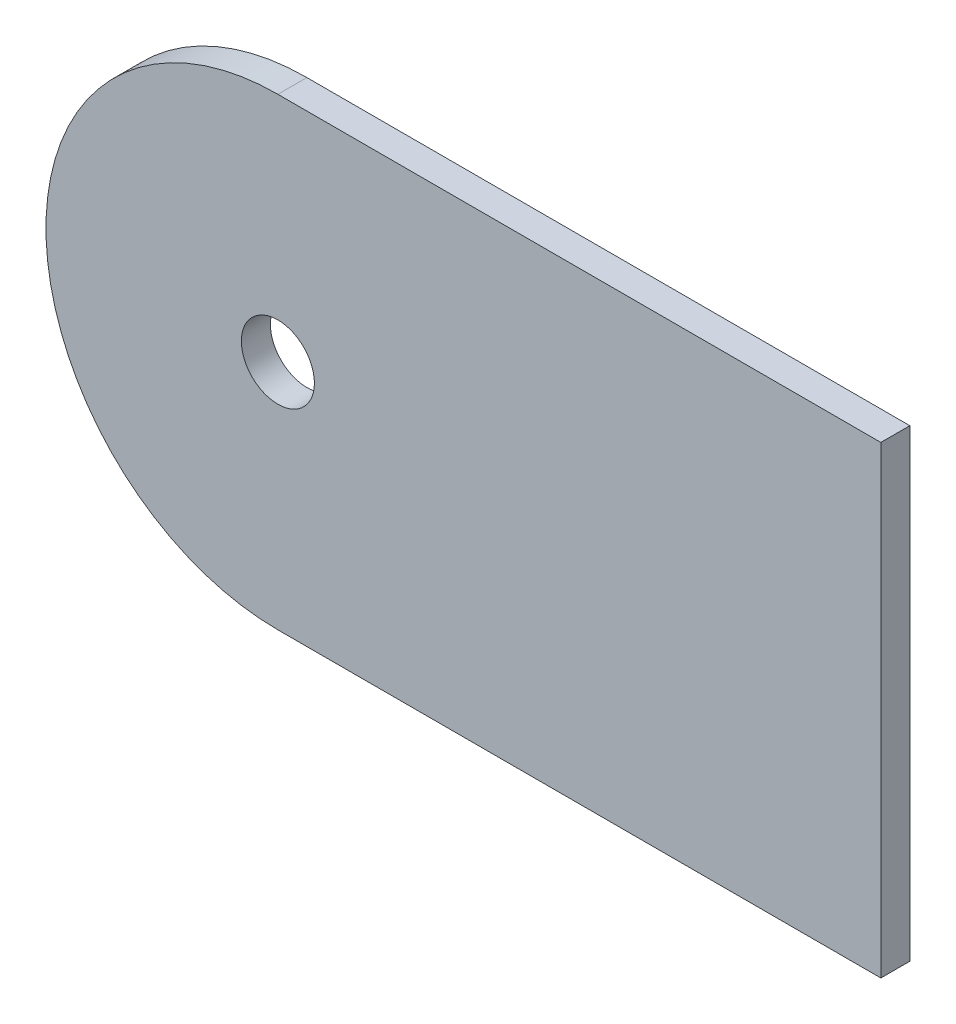
from build123d import *

# Parameters (mm, degrees)
SKETCH1_R           = 2
BOSS_EXTRUDE1_DEPTH = 1.5875


with BuildPart() as part:
    # Sketch1 → Boss-Extrude1 (new body)
    with BuildSketch(Plane.XY):
        with BuildLine():
            Line((0, -12.7), (33.02, -12.7))
            Line((33.02, -12.7), (33.02, 12.7))
            Line((33.02, 12.7), (0, 12.7))
            ThreePointArc((0, 12.7), (-12.7, 0), (0, -12.7))
        make_face()
        Circle(SKETCH1_R, mode=Mode.SUBTRACT)
    extrude(amount=BOSS_EXTRUDE1_DEPTH)


solid = part.part
